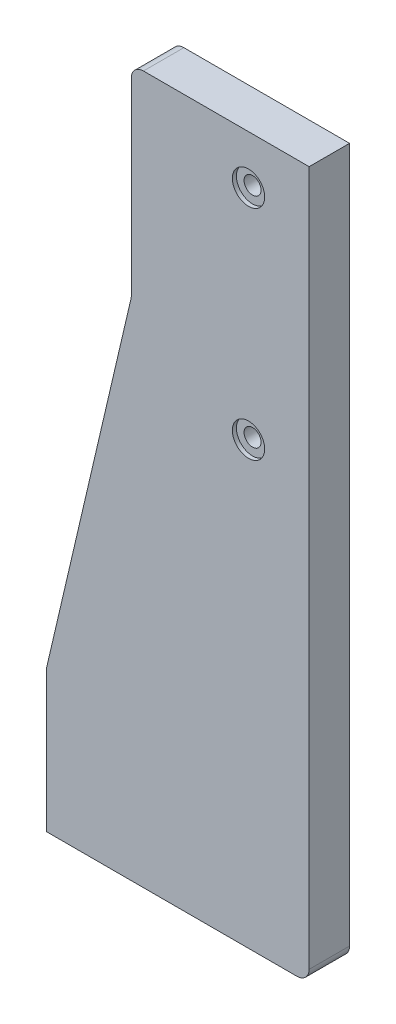
from build123d import *

# Parameters (mm, degrees)
EXTRUDE_4_DEPTH     = 10
SKETCH_11_R         = 2.1
CUT_EXTRUDE_8_DEPTH = 187.949190958
SKETCH_12_R         = 4
CUT_EXTRUDE_9_DEPTH = 1
FILLET_7_R          = 3


with BuildPart() as part:
    # 草图10 → 凸台-拉伸4 (new body)
    with BuildSketch(Plane.XY):
        Polygon((0, 0), (65, 0), (65, 175), (21, 175), (21, 125), (0, 35), align=None)
    extrude(amount=EXTRUDE_4_DEPTH)

    # 草图11 → 切除-拉伸8 (cut, through all)
    with BuildSketch(Plane.XY.offset(10)):
        with Locations((50, 163)):
            Circle(SKETCH_11_R)
        with Locations((50, 109)):
            Circle(SKETCH_11_R)
    extrude(amount=-CUT_EXTRUDE_8_DEPTH, mode=Mode.SUBTRACT)

    # 草图12 → 切除-拉伸9 (cut)
    with BuildSketch(Plane.XY.offset(10)):
        with Locations((50, 163)):
            Circle(SKETCH_12_R)
        with Locations((50, 109)):
            Circle(SKETCH_12_R)
    extrude(amount=-CUT_EXTRUDE_9_DEPTH, mode=Mode.SUBTRACT)

    # 圆角7
    fillet_7_edges = [part.edges().sort_by_distance(p)[0] for p in [
        (65, 0, 5),
        (21, 125, 5),
        (21, 175, 5),
    ]]
    fillet(fillet_7_edges, radius=FILLET_7_R)


solid = part.part
